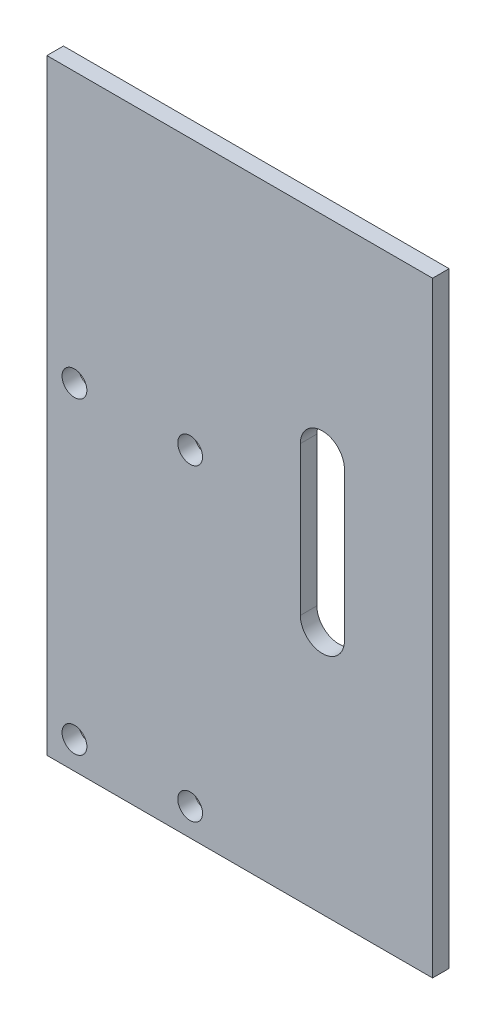
from build123d import *

# Parameters (mm, degrees)
SKIZZE1_W                           = 70
SKIZZE1_H                           = 110
AUFSATZ_LINEAR_AUSTRAGEN1_DEPTH     = 3
DURCHGANGSLOCH_F_R_M41_D            = 4.5
LINEARES_MUSTER1_COUNT              = 2
LINEARES_MUSTER1_PITCH              = 56
LINEARES_MUSTER1_COUNT_DIR2         = 2
LINEARES_MUSTER1_PITCH_DIR2         = 21
F_8_0_8_DURCHMESSER_LANGLOCH4_DEPTH = 3


# Read off the part's stored shape, not the designer's step: Ø8.0 (8) Durchmesser Langloch4
with BuildPart() as part:
    # Skizze1 → Aufsatz-Linear austragen1 (new body)
    with BuildSketch(Plane.XY):
        Rectangle(SKIZZE1_W, SKIZZE1_H)
    extrude(amount=AUFSATZ_LINEAR_AUSTRAGEN1_DEPTH)

    # Durchgangsloch für M41 (through all)
    with Locations(Plane.XY.offset(3)):
        with Locations((-30, -50)):
            durchgangsloch_f_r_m41 = Hole(DURCHGANGSLOCH_F_R_M41_D / 2)

    # Lineares Muster1: Durchgangsloch f_r M41 2 × 2
    with Locations(*[(j * LINEARES_MUSTER1_PITCH_DIR2, i * LINEARES_MUSTER1_PITCH, 0) for i in range(LINEARES_MUSTER1_COUNT) for j in range(LINEARES_MUSTER1_COUNT_DIR2) if (i, j) != (0, 0)]):
        add(durchgangsloch_f_r_m41, mode=Mode.SUBTRACT)

    # Ø8.0 (8) Durchmesser Langloch4 outline → Ø8.0 (8) Durchmesser Langloch4 (cut)
    with BuildSketch(Plane.XY):
        with BuildLine():
            Line((19, -10), (19, 17))
            ThreePointArc((19, 17), (15, 21), (11, 17))
            Line((11, 17), (11, -10))
            ThreePointArc((11, -10), (15, -14), (19, -10))
        make_face()
    extrude(amount=F_8_0_8_DURCHMESSER_LANGLOCH4_DEPTH, mode=Mode.SUBTRACT)


solid = part.part
